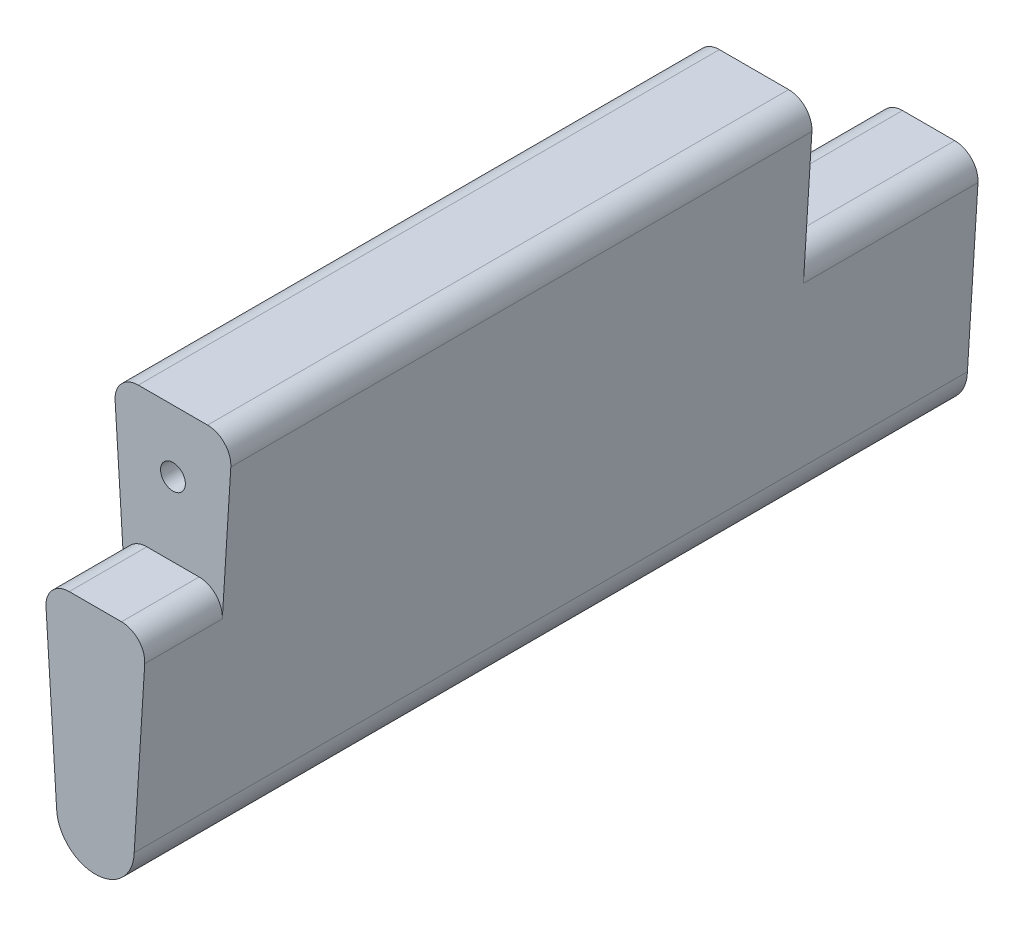
from build123d import *

# Parameters (mm, degrees)
BOSS_EXTRUDE1_DEPTH             = 76.2
BOSS_EXTRUDE1_DEPTH_BACK        = 76.2
CUT_EXTRUDE1_DEPTH              = 136.619651209
CUT_EXTRUDE1_DEPTH_BACK         = 136.619651209
FILLET1_R                       = 3.81
SHELL1_START                    = -44.45
SHELL1_DEPTH                    = 88.773
SHELL1_START_2                  = -73.025
SHELL1_2_DEPTH                  = 130.048
SKETCH14_R                      = 2.032
CUT_EXTRUDE8_DEPTH              = 156.372005628
BOSS_EXTRUDE4_REACH             = 137.201
SKETCH15_R                      = 1.5875
BOSS_EXTRUDE4_DIRECTION_2_REACH = 137.201


# Read off the part's stored shape, not the designer's step: Shell1
with BuildPart() as part:
    # Sketch1 → Boss-Extrude1 (new, two sides: drawn at the far end of the back side and taken through both)
    with BuildSketch(Plane.XY.offset(-BOSS_EXTRUDE1_DEPTH_BACK)):
        with BuildLine():
            Line((-6.335258536, -105.245804705), (-12.685258536, -3.645804705))
            ThreePointArc((-12.685258536, -3.645804705), (0.014741464, 8.866413132), (12.714741464, -3.645804705))
            Line((12.714741464, -3.645804705), (6.364741464, -105.245804705))
            ThreePointArc((6.364741464, -105.245804705), (0.014741464, -111.465623147), (-6.335258536, -105.245804705))
        make_face()
    extrude(amount=BOSS_EXTRUDE1_DEPTH + BOSS_EXTRUDE1_DEPTH_BACK)

    # Sketch4 → Cut-Extrude1 (cut, two sides: drawn at the far end of the back side and taken through both)
    with BuildSketch(Plane(origin=(0, 0, 0), x_dir=(0, 0, -1), z_dir=(1, 0, 0)).offset(-CUT_EXTRUDE1_DEPTH_BACK)):
        Polygon((-47.498, -73.524605007), (-47.498, -51.299605007), (47.625, -51.299605007), (47.625, -73.524605007), (76.2, -73.524605007), (76.2, 8.866413132), (-76.2, 8.866413132), (-76.2, -28.682279346), (-76.2, -111.465623147), (-60.198, -111.465623147), (-60.198, -73.524605007), align=None)
    extrude(amount=CUT_EXTRUDE1_DEPTH + CUT_EXTRUDE1_DEPTH_BACK, mode=Mode.SUBTRACT)

    # Fillet1
    fillet1_edges = [part.edges().sort_by_distance(p)[0] for p in [
        (8.347316445, -73.524605007, 53.848),
        (9.736378945, -51.299605007, -0.0635),
        (-9.706896017, -51.299605007, -0.0635),
        (-8.317833517, -73.524605007, 53.848),
        (-8.317833517, -73.524605007, -61.9125),
        (8.347316445, -73.524605007, -61.9125),
    ]]
    fillet(fillet1_edges, radius=FILLET1_R)

    # Shell1 outline → Shell1 (cut)
    with BuildSketch(Plane.XY.offset(SHELL1_START)):
        with BuildLine():
            ThreePointArc((-3.161602106, -105.125185529), (0.014741465, -108.290623147), (3.191085035, -105.125185529))
            Line((3.191085035, -105.125185529), (6.314583179, -55.149215219))
            ThreePointArc((6.314583179, -55.149215219), (6.143625088, -54.674822007), (5.680819792, -54.474605007))
            Line((5.680819792, -54.474605007), (-5.651336863, -54.474605007))
            ThreePointArc((-5.651336863, -54.474605007), (-6.114142159, -54.674822006), (-6.285100251, -55.149215219))
            Line((-6.285100251, -55.149215219), (-3.161602106, -105.125185529))
        make_face()
    extrude(amount=SHELL1_DEPTH, mode=Mode.SUBTRACT)

    # Shell1 2 outline → Shell1 2 (cut)
    with BuildSketch(Plane.XY.offset(SHELL1_START_2)):
        with BuildLine():
            Line((-4.896037751, -77.374215219), (-3.161602106, -105.125185529))
            ThreePointArc((-3.161602106, -105.125185529), (0.014741465, -108.290623147), (3.191085035, -105.125185529))
            Line((3.191085035, -105.125185529), (4.925520679, -77.374215219))
            ThreePointArc((4.925520679, -77.374215219), (4.754562588, -76.899822007), (4.291757292, -76.699605007))
            Line((4.291757292, -76.699605007), (-4.262274363, -76.699605007))
            ThreePointArc((-4.262274363, -76.699605007), (-4.725079659, -76.899822006), (-4.896037751, -77.374215219))
        make_face()
    extrude(amount=SHELL1_2_DEPTH, mode=Mode.SUBTRACT)

    # Sketch14 → Cut-Extrude8 (cut, through all)
    with BuildSketch(Plane(origin=(0, 0, -47.625), x_dir=(-1, 0, 0), z_dir=(0, 0, -1))):
        with Locations((-0.014741464, -61.459605007)):
            Circle(SKETCH14_R)
    extrude(amount=-CUT_EXTRUDE8_DEPTH, mode=Mode.SUBTRACT)

    # Boss-Extrude4: up to this plane
    boss_extrude4_end = Plane(origin=(3.195924528, -105.047753647, -76.2), z_dir=(0.9980525784828886, -0.062378286155180485, 0))
    # Sketch15 → Boss-Extrude4 (add, up to the surface)
    with BuildSketch(Plane(origin=(3.191103822, -0.502900096, 0), x_dir=(0, 0, -1), z_dir=(1, 0, 0)), mode=Mode.PRIVATE) as boss_extrude4_sk1:
        with Locations(Location((-9.398, -66.274366182, 0), (0, 0, 270))):
            Circle(SKETCH15_R)
    boss_extrude4_tool1 = split(extrude(boss_extrude4_sk1.sketch, amount=BOSS_EXTRUDE4_REACH, mode=Mode.PRIVATE), bisect_by=boss_extrude4_end, keep=Keep.BOTH, mode=Mode.PRIVATE)
    add(boss_extrude4_tool1.solids().sort_by_distance((3.191104, -66.777266, 9.398))[0])
    # Sketch15 → Boss-Extrude4 (add, up to the surface)
    with BuildSketch(Plane(origin=(3.191103822, -0.502900096, 0), x_dir=(0, 0, -1), z_dir=(1, 0, 0)), mode=Mode.PRIVATE) as boss_extrude4_sk2:
        with Locations(Location((26.868345804, -77.595887652, 0), (0, 0, 270))):
            Circle(SKETCH15_R)
    boss_extrude4_tool2 = split(extrude(boss_extrude4_sk2.sketch, amount=BOSS_EXTRUDE4_REACH, mode=Mode.PRIVATE), bisect_by=boss_extrude4_end, keep=Keep.BOTH, mode=Mode.PRIVATE)
    add(boss_extrude4_tool2.solids().sort_by_distance((3.191104, -78.098788, -26.868346))[0])
    # Sketch15 → Boss-Extrude4 (add, up to the surface)
    with BuildSketch(Plane(origin=(3.191103822, -0.502900096, 0), x_dir=(0, 0, -1), z_dir=(1, 0, 0)), mode=Mode.PRIVATE) as boss_extrude4_sk3:
        with Locations(Location((-22.098, -96.55076585, 0), (0, 0, 270))):
            Circle(SKETCH15_R)
    boss_extrude4_tool3 = split(extrude(boss_extrude4_sk3.sketch, amount=BOSS_EXTRUDE4_REACH, mode=Mode.PRIVATE), bisect_by=boss_extrude4_end, keep=Keep.BOTH, mode=Mode.PRIVATE)
    add(boss_extrude4_tool3.solids().sort_by_distance((3.191104, -97.053666, 22.098))[0])
    # Sketch15 → Boss-Extrude4 (add, up to the surface)
    with BuildSketch(Plane(origin=(3.191103822, -0.502900096, 0), x_dir=(0, 0, -1), z_dir=(1, 0, 0)), mode=Mode.PRIVATE) as boss_extrude4_sk4:
        with Locations(Location((16.002, -96.55076585, 0), (0, 0, 270))):
            Circle(SKETCH15_R)
    boss_extrude4_tool4 = split(extrude(boss_extrude4_sk4.sketch, amount=BOSS_EXTRUDE4_REACH, mode=Mode.PRIVATE), bisect_by=boss_extrude4_end, keep=Keep.BOTH, mode=Mode.PRIVATE)
    add(boss_extrude4_tool4.solids().sort_by_distance((3.191104, -97.053666, -16.002))[0])
    # Sketch15 → Boss-Extrude4 (add, up to the surface)
    with BuildSketch(Plane(origin=(3.191103822, -0.502900096, 0), x_dir=(0, 0, -1), z_dir=(1, 0, 0)), mode=Mode.PRIVATE) as boss_extrude4_sk5:
        with Locations(Location((54.102, -96.55076585, 0), (0, 0, 270))):
            Circle(SKETCH15_R)
    boss_extrude4_tool5 = split(extrude(boss_extrude4_sk5.sketch, amount=BOSS_EXTRUDE4_REACH, mode=Mode.PRIVATE), bisect_by=boss_extrude4_end, keep=Keep.BOTH, mode=Mode.PRIVATE)
    add(boss_extrude4_tool5.solids().sort_by_distance((3.191104, -97.053666, -54.102))[0])

    # Boss-Extrude4 direction 2: up to this plane
    boss_extrude4_direction_2_end = Plane(origin=(-3.166441599, -105.047753647, -76.2), z_dir=(-0.9980525784828886, -0.0623782861551806, 0))
    # Sketch15 → Boss-Extrude4 direction 2 (add, up to the surface)
    with BuildSketch(Plane(origin=(3.191103822, -0.502900096, 0), x_dir=(0, 0, -1), z_dir=(1, 0, 0)), mode=Mode.PRIVATE) as boss_extrude4_direction_2_sk1:
        with Locations(Location((-9.398, -66.274366182, 0), (0, 0, 270))):
            Circle(SKETCH15_R)
    boss_extrude4_direction_2_tool1 = split(extrude(boss_extrude4_direction_2_sk1.sketch, amount=-BOSS_EXTRUDE4_DIRECTION_2_REACH, mode=Mode.PRIVATE), bisect_by=boss_extrude4_direction_2_end, keep=Keep.BOTH, mode=Mode.PRIVATE)
    add(boss_extrude4_direction_2_tool1.solids().sort_by_distance((3.191104, -66.777266, 9.398))[0])
    # Sketch15 → Boss-Extrude4 direction 2 (add, up to the surface)
    with BuildSketch(Plane(origin=(3.191103822, -0.502900096, 0), x_dir=(0, 0, -1), z_dir=(1, 0, 0)), mode=Mode.PRIVATE) as boss_extrude4_direction_2_sk2:
        with Locations(Location((26.868345804, -77.595887652, 0), (0, 0, 270))):
            Circle(SKETCH15_R)
    boss_extrude4_direction_2_tool2 = split(extrude(boss_extrude4_direction_2_sk2.sketch, amount=-BOSS_EXTRUDE4_DIRECTION_2_REACH, mode=Mode.PRIVATE), bisect_by=boss_extrude4_direction_2_end, keep=Keep.BOTH, mode=Mode.PRIVATE)
    add(boss_extrude4_direction_2_tool2.solids().sort_by_distance((3.191104, -78.098788, -26.868346))[0])
    # Sketch15 → Boss-Extrude4 direction 2 (add, up to the surface)
    with BuildSketch(Plane(origin=(3.191103822, -0.502900096, 0), x_dir=(0, 0, -1), z_dir=(1, 0, 0)), mode=Mode.PRIVATE) as boss_extrude4_direction_2_sk3:
        with Locations(Location((-22.098, -96.55076585, 0), (0, 0, 270))):
            Circle(SKETCH15_R)
    boss_extrude4_direction_2_tool3 = split(extrude(boss_extrude4_direction_2_sk3.sketch, amount=-BOSS_EXTRUDE4_DIRECTION_2_REACH, mode=Mode.PRIVATE), bisect_by=boss_extrude4_direction_2_end, keep=Keep.BOTH, mode=Mode.PRIVATE)
    add(boss_extrude4_direction_2_tool3.solids().sort_by_distance((3.191104, -97.053666, 22.098))[0])
    # Sketch15 → Boss-Extrude4 direction 2 (add, up to the surface)
    with BuildSketch(Plane(origin=(3.191103822, -0.502900096, 0), x_dir=(0, 0, -1), z_dir=(1, 0, 0)), mode=Mode.PRIVATE) as boss_extrude4_direction_2_sk4:
        with Locations(Location((16.002, -96.55076585, 0), (0, 0, 270))):
            Circle(SKETCH15_R)
    boss_extrude4_direction_2_tool4 = split(extrude(boss_extrude4_direction_2_sk4.sketch, amount=-BOSS_EXTRUDE4_DIRECTION_2_REACH, mode=Mode.PRIVATE), bisect_by=boss_extrude4_direction_2_end, keep=Keep.BOTH, mode=Mode.PRIVATE)
    add(boss_extrude4_direction_2_tool4.solids().sort_by_distance((3.191104, -97.053666, -16.002))[0])
    # Sketch15 → Boss-Extrude4 direction 2 (add, up to the surface)
    with BuildSketch(Plane(origin=(3.191103822, -0.502900096, 0), x_dir=(0, 0, -1), z_dir=(1, 0, 0)), mode=Mode.PRIVATE) as boss_extrude4_direction_2_sk5:
        with Locations(Location((54.102, -96.55076585, 0), (0, 0, 270))):
            Circle(SKETCH15_R)
    boss_extrude4_direction_2_tool5 = split(extrude(boss_extrude4_direction_2_sk5.sketch, amount=-BOSS_EXTRUDE4_DIRECTION_2_REACH, mode=Mode.PRIVATE), bisect_by=boss_extrude4_direction_2_end, keep=Keep.BOTH, mode=Mode.PRIVATE)
    add(boss_extrude4_direction_2_tool5.solids().sort_by_distance((3.191104, -97.053666, -54.102))[0])


solid = part.part
